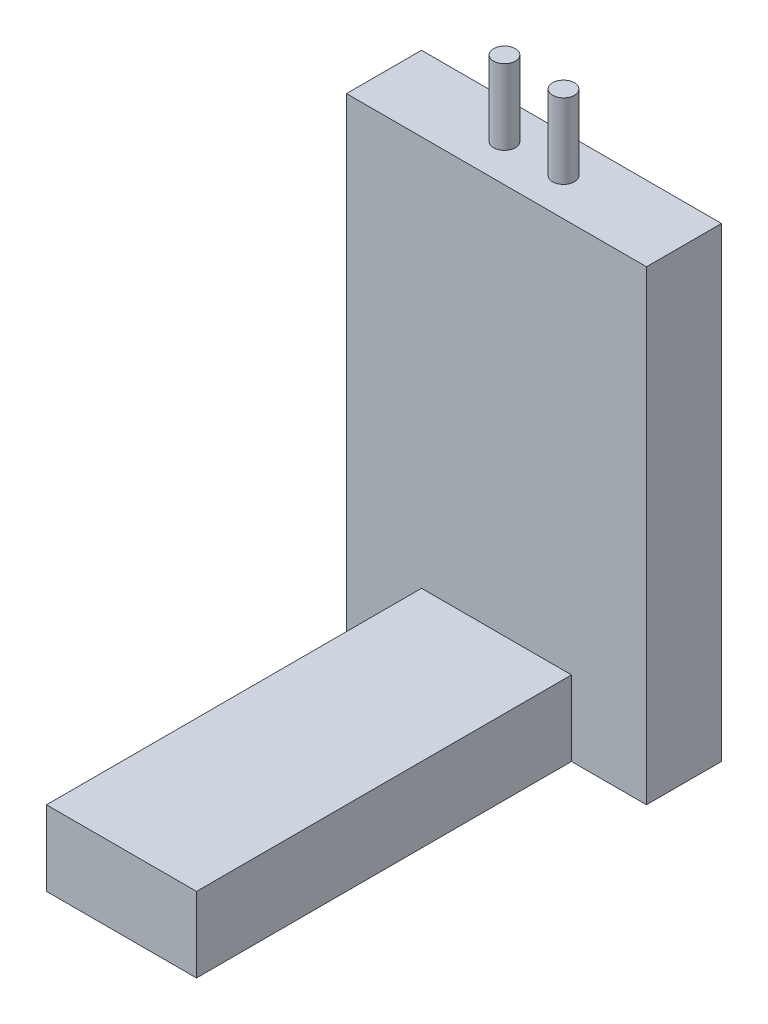
from build123d import *

# Parameters (mm, degrees)
SKETCH3_W           = 101.6
SKETCH3_H           = 25.4
BOSS_EXTRUDE1_DEPTH = 157.8
SKETCH6_R           = 3.683
BOSS_EXTRUDE4_DEPTH = 25.4
SKETCH7_R           = 5.207
CUT_EXTRUDE1_DEPTH  = 17.78
SKETCH8_W           = 50.8
SKETCH8_H           = 25.4
BOSS_EXTRUDE5_DEPTH = 127


with BuildPart() as part:
    # Sketch3 → Boss-Extrude1 (new body)
    with BuildSketch(Plane(origin=(0, 0, 0), x_dir=(1, 0, 0), z_dir=(0, 1, 0))):
        with Locations((25.4, 12.7)):
            Rectangle(SKETCH3_W, SKETCH3_H)
    extrude(amount=BOSS_EXTRUDE1_DEPTH)

    # Sketch6 → Boss-Extrude4 (add)
    with BuildSketch(Plane(origin=(0, 157.8, 0), x_dir=(1, 0, 0), z_dir=(0, 1, 0))):
        with Locations((15.4, 12.7)):
            Circle(SKETCH6_R)
        with Locations((35.4, 12.7)):
            Circle(SKETCH6_R)
    extrude(amount=BOSS_EXTRUDE4_DEPTH)

    # Sketch7 → Cut-Extrude1 (cut)
    with BuildSketch(Plane(origin=(0, 0, 0), x_dir=(-1, 0, 0), z_dir=(0, -1, 0))):
        with Locations((5.08, 12.7)):
            Circle(SKETCH7_R)
        with Locations((-55.88, 12.7)):
            Circle(SKETCH7_R)
    extrude(amount=-CUT_EXTRUDE1_DEPTH, mode=Mode.SUBTRACT)

    # Sketch8 → Boss-Extrude5 (add)
    with BuildSketch(Plane.XY):
        with Locations((25.4, 12.7)):
            Rectangle(SKETCH8_W, SKETCH8_H)
    extrude(amount=BOSS_EXTRUDE5_DEPTH)


solid = part.part
